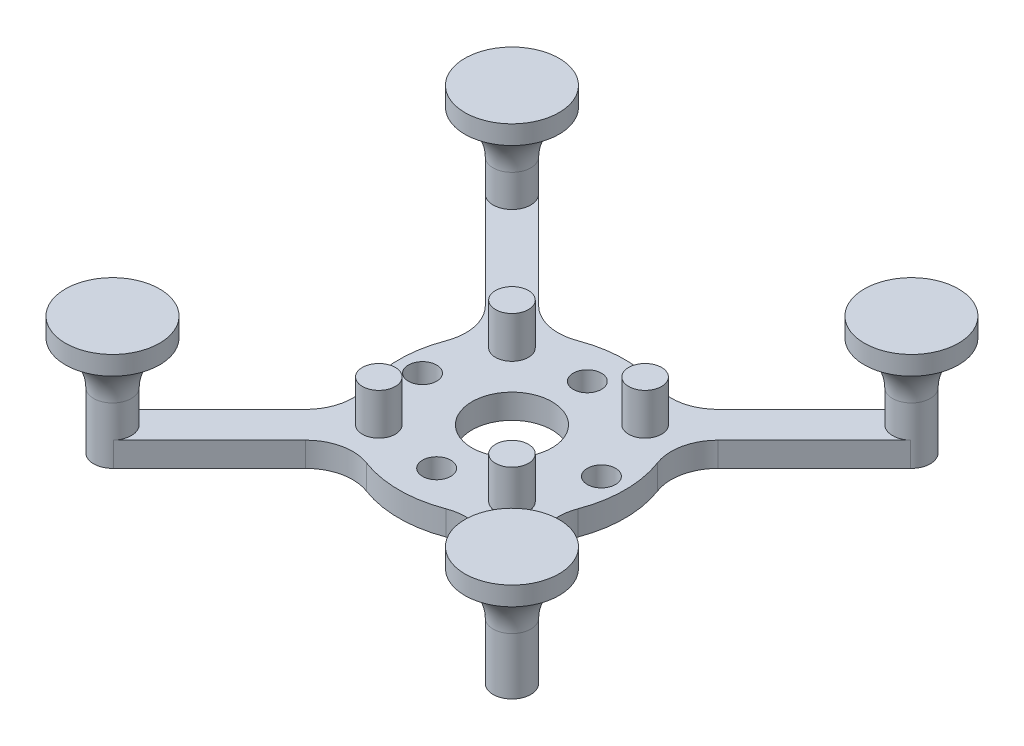
from build123d import *

# Parameters (mm, degrees)
SKETCH1_R           = 12
SKETCH1_R_2         = 1.5
SKETCH1_R_3         = 4.25
BOSS_EXTRUDE1_DEPTH = 2.6
SKETCH2_R           = 1.75
BOSS_EXTRUDE2_DEPTH = 4.4
BOSS_EXTRUDE3_DEPTH = 2.6
BOSS_EXTRUDE4_START = 10
SKETCH5_R           = 2.001113277
BOSS_EXTRUDE4_DEPTH = 10
SKETCH6_R           = 5
BOSS_EXTRUDE5_DEPTH = 2
FILLET1_R           = 5


with BuildPart() as part:
    # Sketch1 → Boss-Extrude1 (new body)
    with BuildSketch(Plane(origin=(0, 0, 0), x_dir=(1, 0, 0), z_dir=(0, 1, 0))):
        with Locations(Location((0, 0, 0), (0, 0, 270))):
            Circle(SKETCH1_R)
        with Locations(Location((0, 8, 0), (0, 0, 270))):
            Circle(SKETCH1_R_2, mode=Mode.SUBTRACT)
        with Locations(Location((9.5, 0, 0), (0, 0, 270))):
            Circle(SKETCH1_R_2, mode=Mode.SUBTRACT)
        with Locations(Location((0, -8, 0), (0, 0, 270))):
            Circle(SKETCH1_R_2, mode=Mode.SUBTRACT)
        with Locations(Location((-9.5, 0, 0), (0, 0, 270))):
            Circle(SKETCH1_R_2, mode=Mode.SUBTRACT)
        with Locations(Location((0, 0, 0), (0, 0, 270))):
            Circle(SKETCH1_R_3, mode=Mode.SUBTRACT)
    extrude(amount=BOSS_EXTRUDE1_DEPTH)

    # Sketch2 → Boss-Extrude2 (add)
    with BuildSketch(Plane(origin=(0, 2.6, 0), x_dir=(1, 0, 0), z_dir=(0, 1, 0))):
        with Locations(Location((-7.071067812, 7.071067812, 0), (0, 0, 270))):
            Circle(SKETCH2_R)
        with Locations(Location((7.071067812, 7.071067812, 0), (0, 0, 270))):
            Circle(SKETCH2_R)
        with Locations(Location((7.071067812, -7.071067812, 0), (0, 0, 270))):
            Circle(SKETCH2_R)
        with Locations(Location((-7.071067812, -7.071067812, 0), (0, 0, 270))):
            Circle(SKETCH2_R)
    extrude(amount=BOSS_EXTRUDE2_DEPTH)

    # Sketch3 → Boss-Extrude3 (add)
    with BuildSketch(Plane(origin=(0, 2.6, 0), x_dir=(1, 0, 0), z_dir=(0, 1, 0))):
        with BuildLine():
            Line((-22.580224051, 19.751796926), (-9.780813828, 6.952386703))
            ThreePointArc((-9.780813828, 6.952386703), (-8.455336604, 8.455336604), (-6.952386703, 9.780813828))
            Line((-6.952386703, 9.780813828), (-19.751796926, 22.580224051))
            ThreePointArc((-19.751796926, 22.580224051), (-22.628204204, 22.628204204), (-22.580224051, 19.751796926))
        make_face()
        with BuildLine():
            Line((19.751796926, 22.580224051), (6.952386703, 9.780813828))
            ThreePointArc((6.952386703, 9.780813828), (8.455336604, 8.455336604), (9.780813828, 6.952386703))
            Line((9.780813828, 6.952386703), (22.580224051, 19.751796926))
            ThreePointArc((22.580224051, 19.751796926), (22.628204204, 22.628204204), (19.751796926, 22.580224051))
        make_face()
        with BuildLine():
            Line((22.580224051, -19.751796926), (9.780813828, -6.952386703))
            ThreePointArc((9.780813828, -6.952386703), (8.455336604, -8.455336604), (6.952386703, -9.780813828))
            Line((6.952386703, -9.780813828), (19.751796926, -22.580224051))
            ThreePointArc((19.751796926, -22.580224051), (22.628204204, -22.628204204), (22.580224051, -19.751796926))
        make_face()
        with BuildLine():
            Line((-19.751796926, -22.580224051), (-6.952386703, -9.780813828))
            ThreePointArc((-6.952386703, -9.780813828), (-8.455336604, -8.455336604), (-9.780813828, -6.952386703))
            Line((-9.780813828, -6.952386703), (-22.580224051, -19.751796926))
            ThreePointArc((-22.580224051, -19.751796926), (-22.628204204, -22.628204204), (-19.751796926, -22.580224051))
        make_face()
    extrude(amount=-BOSS_EXTRUDE3_DEPTH)

    # Sketch5 → Boss-Extrude4 (add)
    with BuildSketch(Plane(origin=(0, 2.6, 0), x_dir=(1, 0, 0), z_dir=(0, 1, 0)).offset(BOSS_EXTRUDE4_START)):
        with Locations(Location((-21.213203436, 21.213203436, 0), (0, 0, 270))):
            Circle(SKETCH5_R)
        with Locations(Location((21.213203436, 21.213203436, 0), (0, 0, 270))):
            Circle(SKETCH5_R)
        with Locations(Location((21.213203436, -21.213203436, 0), (0, 0, 270))):
            Circle(SKETCH5_R)
        with Locations(Location((-21.213203436, -21.213203436, 0), (0, 0, 270))):
            Circle(SKETCH5_R)
    extrude(amount=-BOSS_EXTRUDE4_DEPTH)

    # Sketch6 → Boss-Extrude5 (add)
    with BuildSketch(Plane(origin=(0, 12.6, 0), x_dir=(1, 0, 0), z_dir=(0, 1, 0))):
        with Locations(Location((21.213203436, -21.213203436, 0), (0, 0, 270))):
            Circle(SKETCH6_R)
        with Locations(Location((21.213203436, 21.213203436, 0), (0, 0, 270))):
            Circle(SKETCH6_R)
        with Locations(Location((-21.213203436, 21.213203436, 0), (0, 0, 270))):
            Circle(SKETCH6_R)
        with Locations(Location((-21.213203436, -21.213203436, 0), (0, 0, 270))):
            Circle(SKETCH6_R)
    extrude(amount=-BOSS_EXTRUDE5_DEPTH)

    # Fillet1
    fillet1_edges = [part.edges().sort_by_distance(p)[0] for p in [
        (-6.952386703, 1.3, -9.780813828),
        (-9.780813828, 1.3, -6.952386703),
        (9.780813828, 1.3, -6.952386703),
        (6.952386703, 1.3, -9.780813828),
        (6.952386703, 1.3, 9.780813828),
        (9.780813828, 1.3, 6.952386703),
        (-9.780813828, 1.3, 6.952386703),
        (-6.952386703, 1.3, 9.780813828),
    ]]
    fillet(fillet1_edges, radius=FILLET1_R)

    # Fillet2: read off the stored shape, not the designer's step
    # Fillet2 outline → Fillet2 (revolve)
    with BuildSketch(Plane(origin=(-21.213203436, 0, 21.213203436), x_dir=(1, 0, 0), z_dir=(0, 0, 1))):
        with BuildLine():
            ThreePointArc((2.001113277, 6.01791034), (2.817480503, 8.756014941), (5, 10.6))
            Line((5, 10.6), (2.001113277, 10.6))
            Line((2.001113277, 10.6), (2.001113277, 6.01791034))
        make_face()
    revolve(axis=Axis((-21.213203436, 0, 21.213203436), (0, 1, 0)))

    # Fillet2 2 outline → Fillet2 2 (revolve)
    with BuildSketch(Plane(origin=(21.213203436, 0, 21.213203436), x_dir=(1, 0, 0), z_dir=(0, 0, 1))):
        with BuildLine():
            ThreePointArc((2.001113277, 6.01791034), (2.817480503, 8.756014941), (5, 10.6))
            Line((5, 10.6), (2.001113277, 10.6))
            Line((2.001113277, 10.6), (2.001113277, 6.01791034))
        make_face()
    revolve(axis=Axis((21.213203436, 0, 21.213203436), (0, 1, 0)))

    # Fillet2 3 outline → Fillet2 3 (revolve)
    with BuildSketch(Plane(origin=(21.213203436, 0, -21.213203436), x_dir=(1, 0, 0), z_dir=(0, 0, 1))):
        with BuildLine():
            ThreePointArc((2.001113277, 6.01791034), (2.817480503, 8.756014941), (5, 10.6))
            Line((5, 10.6), (2.001113277, 10.6))
            Line((2.001113277, 10.6), (2.001113277, 6.01791034))
        make_face()
    revolve(axis=Axis((21.213203436, 0, -21.213203436), (0, 1, 0)))

    # Fillet2 4 outline → Fillet2 4 (revolve)
    with BuildSketch(Plane(origin=(-21.213203436, 0, -21.213203436), x_dir=(1, 0, 0), z_dir=(0, 0, 1))):
        with BuildLine():
            ThreePointArc((2.001113277, 6.01791034), (2.817480503, 8.756014941), (5, 10.6))
            Line((5, 10.6), (2.001113277, 10.6))
            Line((2.001113277, 10.6), (2.001113277, 6.01791034))
        make_face()
    revolve(axis=Axis((-21.213203436, 0, -21.213203436), (0, 1, 0)))


solid = part.part
